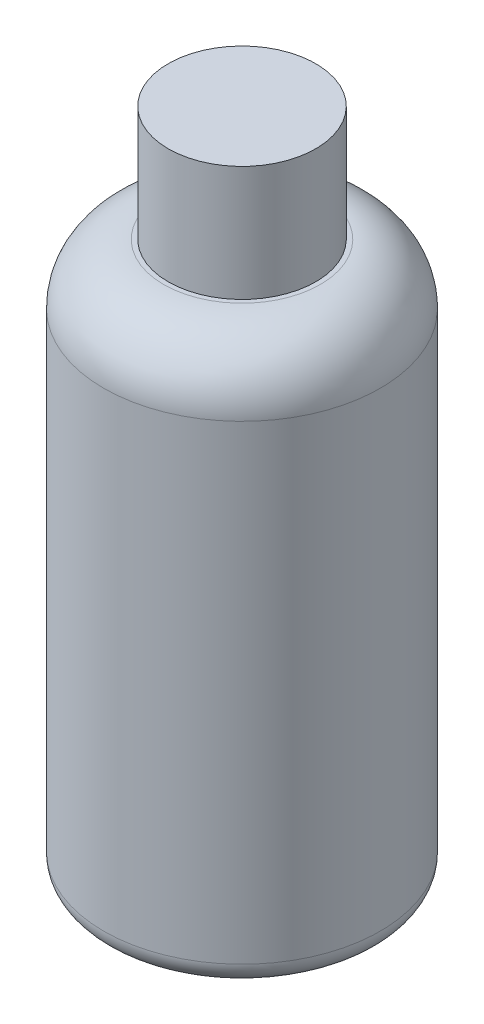
from build123d import *

# Parameters (mm, degrees)
SKETCH1_R           = 30
BOSS_EXTRUDE1_DEPTH = 120
SKETCH2_R           = 16
BOSS_EXTRUDE2_DEPTH = 25
FILLET1_R           = 13
SHELL2_T            = -1
SKETCH3_R           = 30
BOSS_EXTRUDE3_DEPTH = 1
FILLET2_R           = 5


with BuildPart() as part:
    # Sketch1 → Boss-Extrude1 (new body)
    with BuildSketch(Plane(origin=(0, 0, 0), x_dir=(1, 0, 0), z_dir=(0, 1, 0))):
        Circle(SKETCH1_R)
    extrude(amount=BOSS_EXTRUDE1_DEPTH)

    # Sketch2 → Boss-Extrude2 (add)
    with BuildSketch(Plane(origin=(0, 120, 0), x_dir=(1, 0, 0), z_dir=(0, 1, 0))):
        Circle(SKETCH2_R)
    extrude(amount=BOSS_EXTRUDE2_DEPTH)

    # Fillet1
    fillet1_edges = [part.edges().sort_by_distance(p)[0] for p in [
        (-30, 120, 0),
    ]]
    fillet(fillet1_edges, radius=FILLET1_R)

    # Shell2
    shell2_openings = [part.faces().sort_by_distance(p)[0] for p in [
        (0, 0, 0),
    ]]
    offset(amount=SHELL2_T, openings=shell2_openings, kind=Kind.INTERSECTION)

    # Sketch3 → Boss-Extrude3 (add)
    with BuildSketch(Plane.XZ):
        Circle(SKETCH3_R)
    extrude(amount=-BOSS_EXTRUDE3_DEPTH)


with BuildPart() as body_2:
    # Split1: the piece on the far side of the plane
    add(part.part)
    split(bisect_by=Plane.ZX.offset(120), keep=Keep.BOTTOM)

    # Fillet2
    fillet2_edges = [body_2.edges().sort_by_distance(p)[0] for p in [
        (-30, 0, 0),
        (-29, 1, 0),
    ]]
    fillet(fillet2_edges, radius=FILLET2_R)


with BuildPart() as part_1:
    add(part.part)

    # Split1
    split(bisect_by=Plane.ZX.offset(120), keep=Keep.TOP)


solid = Compound([body_2.part, part_1.part])
